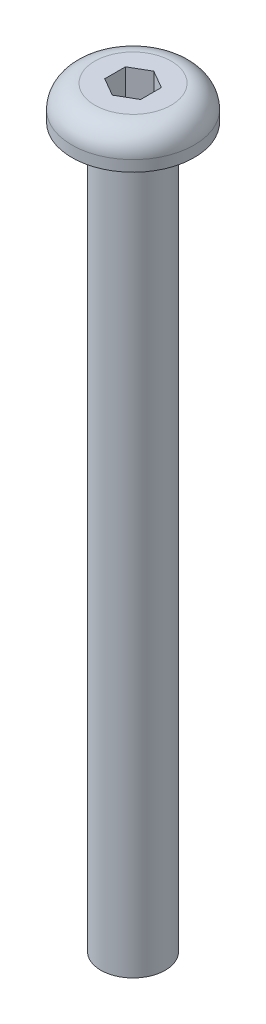
from build123d import *

# Parameters (mm, degrees)
SKETCH1_R           = 1.4224
BOSS_EXTRUDE1_DEPTH = 31.75
SKETCH2_R           = 2.7051
BOSS_EXTRUDE2_DEPTH = 1.4986
FILLET1_R           = 1.016
CUT_EXTRUDE1_DEPTH  = 2.38125


with BuildPart() as part:
    # Sketch1 → Boss-Extrude1 (new body)
    with BuildSketch(Plane(origin=(0, 0, 0), x_dir=(1, 0, 0), z_dir=(0, 1, 0))):
        Circle(SKETCH1_R)
    extrude(amount=BOSS_EXTRUDE1_DEPTH)

    # Sketch2 → Boss-Extrude2 (add)
    with BuildSketch(Plane(origin=(0, 31.75, 0), x_dir=(1, 0, 0), z_dir=(0, 1, 0))):
        Circle(SKETCH2_R)
    extrude(amount=BOSS_EXTRUDE2_DEPTH)

    # Fillet1
    fillet1_edges = [part.edges().sort_by_distance(p)[0] for p in [
        (-2.7051, 33.2486, 0),
    ]]
    fillet(fillet1_edges, radius=FILLET1_R)

    # Sketch3 → Cut-Extrude1 (cut)
    with BuildSketch(Plane(origin=(0, 33.2486, 0), x_dir=(1, 0, 0), z_dir=(0, 1, 0))):
        Polygon((0, 0.916543552), (-0.79375, 0.458271776), (-0.79375, -0.458271776), (0, -0.916543552), (0.79375, -0.458271776), (0.79375, 0.458271776), align=None)
    extrude(amount=-CUT_EXTRUDE1_DEPTH, mode=Mode.SUBTRACT)


solid = part.part
